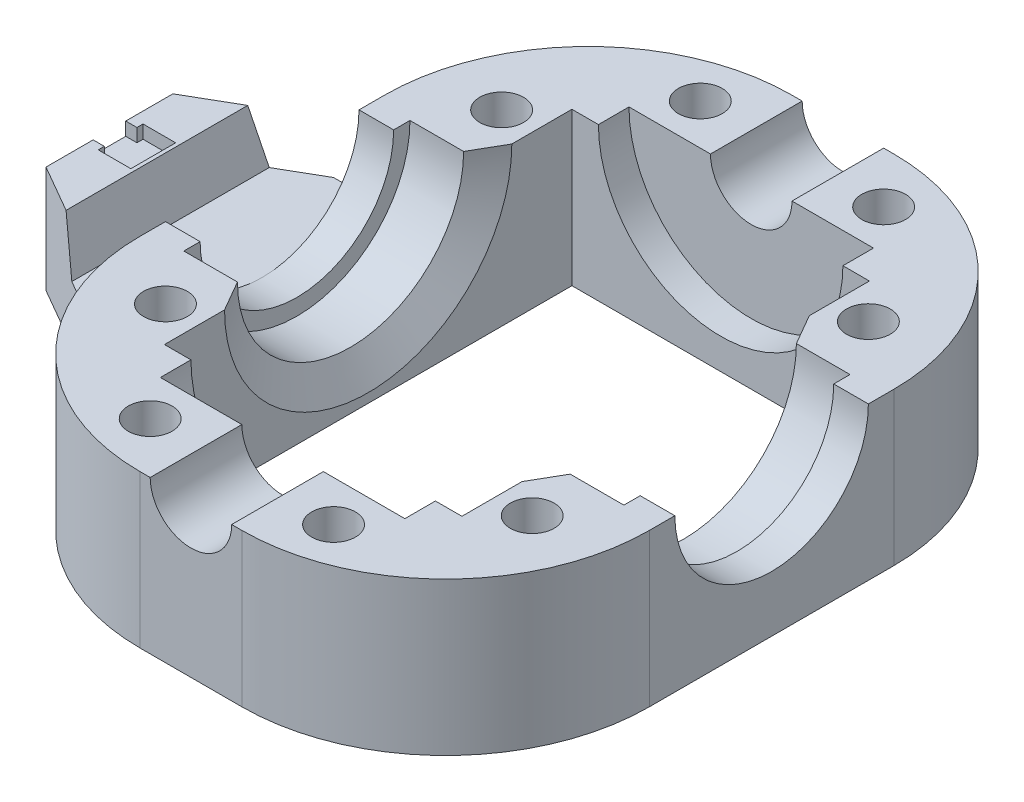
from build123d import *
from OCP.BRepFilletAPI import BRepFilletAPI_MakeChamfer

# Parameters (mm, degrees)
SKETCH1_W           = 50
SKETCH1_H           = 64
SKETCH1_W_2         = 29.2
SKETCH1_H_2         = 40
BOSS_EXTRUDE1_DEPTH = 15
SKETCH3_W           = 7
SKETCH3_H           = 11.1
SKETCH4_R           = 9.5
CUT_EXTRUDE2_DEPTH  = 62.229078059
SKETCH5_R           = 4
CUT_EXTRUDE3_DEPTH  = 71.32780389
SKETCH8_R           = 2.15
CUT_EXTRUDE6_DEPTH  = 44.289721644
FILLET1_R           = 20
CHAMFER1_SIZE       = 3
CHAMFER1_SIZE2      = 1.732050808
SKETCH9_W           = 12
SKETCH9_H           = 3
SKETCH10_W          = 24
SKETCH10_H          = 5.5
BOSS_EXTRUDE2_DEPTH = 15
BOSS_EXTRUDE3_START = 9
SKETCH12_W          = 24
SKETCH12_H          = 3.7
BOSS_EXTRUDE3_DEPTH = 6
BOSS_EXTRUDE4_DEPTH = 1.3
CHAMFER2_SIZE2      = 1.339745962
CHAMFER2_SIZE       = 5
CHAMFER3_SIZE       = 10
CHAMFER3_SIZE2      = 5.773502692


with BuildPart() as part:
    # Sketch1 → Boss-Extrude1 (new body)
    with BuildSketch(Plane(origin=(0, 0, 0), x_dir=(1, 0, 0), z_dir=(0, 1, 0))):
        Rectangle(SKETCH1_W, SKETCH1_H)
        Rectangle(SKETCH1_W_2, SKETCH1_H_2, mode=Mode.SUBTRACT)
    extrude(amount=BOSS_EXTRUDE1_DEPTH)

    # Sketch3 → Cut-Revolve1 (revolve, cut)
    with BuildSketch(Plane(origin=(0, 15, 0), x_dir=(1, 0, 0), z_dir=(0, 1, 0))):
        with Locations((18.1, -5.55)):
            Rectangle(SKETCH3_W, SKETCH3_H)
        with Locations((-18.1, -5.55)):
            Rectangle(SKETCH3_W, SKETCH3_H)
    revolve(axis=Axis((14.6, 15, 0), (1, 0, 0)), mode=Mode.SUBTRACT)

    # Sketch4 → Cut-Extrude2 (cut, through all)
    with BuildSketch(Plane(origin=(25, 0, 0), x_dir=(0, 0, -1), z_dir=(1, 0, 0))):
        with Locations((0, 15)):
            Circle(SKETCH4_R)
    extrude(amount=-CUT_EXTRUDE2_DEPTH, mode=Mode.SUBTRACT)

    # Sketch5 → Cut-Extrude3 (cut, through all)
    with BuildSketch(Plane.XY.offset(32)):
        with Locations((0, 15)):
            Circle(SKETCH5_R)
    extrude(amount=-CUT_EXTRUDE3_DEPTH, mode=Mode.SUBTRACT)

    # Sketch8 → Cut-Extrude6 (cut, through all)
    with BuildSketch(Plane(origin=(0, 15, 0), x_dir=(1, 0, 0), z_dir=(0, 1, 0))):
        with Locations(Location((18, 16.5, 0), (0, 0, 270))):
            Circle(SKETCH8_R)
        with Locations(Location((18, -16.5, 0), (0, 0, 270))):
            Circle(SKETCH8_R)
        with Locations(Location((-18, -16.5, 0), (0, 0, 270))):
            Circle(SKETCH8_R)
        with Locations(Location((-18, 16.5, 0), (0, 0, 270))):
            Circle(SKETCH8_R)
        with Locations(Location((9, -27, 0), (0, 0, 270))):
            Circle(SKETCH8_R)
        with Locations(Location((-9, -27, 0), (0, 0, 270))):
            Circle(SKETCH8_R)
        with Locations(Location((-9, 27, 0), (0, 0, 270))):
            Circle(SKETCH8_R)
        with Locations(Location((9, 27, 0), (0, 0, 270))):
            Circle(SKETCH8_R)
    extrude(amount=-CUT_EXTRUDE6_DEPTH, mode=Mode.SUBTRACT)

    # Fillet1
    fillet1_edges = [part.edges().sort_by_distance(p)[0] for p in [
        (-25, 7.5, -32),
        (25, 7.5, -32),
        (25, 7.5, 32),
        (-25, 7.5, 32),
    ]]
    fillet(fillet1_edges, radius=FILLET1_R)

    # Chamfer1: one chamfer whose edges measure the first distance from different faces: ONE call of the kernel's chamfer builder (chamfer() names one face for all edges)
    chamfer1_edges_1 = [part.edges().sort_by_distance(p)[0] for p in [
        (14.6, 3.9, 0),
    ]]
    chamfer1_side_1 = [part.faces().sort_by_distance(p)[0] for p in [
        (14.6, 0.427200187, 0),
    ]]
    chamfer1_edges_2 = [part.edges().sort_by_distance(p)[0] for p in [
        (-14.6, 3.9, 0),
    ]]
    chamfer1_side_2 = [part.faces().sort_by_distance(p)[0] for p in [
        (-14.6, 0.427200187, 0),
    ]]
    chamfer1 = BRepFilletAPI_MakeChamfer(part.part.solid().wrapped)
    for e in chamfer1_edges_1:
        chamfer1.Add(CHAMFER1_SIZE, CHAMFER1_SIZE2, e.wrapped, chamfer1_side_1[0].wrapped)  # the first distance lies on this face
    for e in chamfer1_edges_2:
        chamfer1.Add(CHAMFER1_SIZE, CHAMFER1_SIZE2, e.wrapped, chamfer1_side_2[0].wrapped)  # the first distance lies on this face
    add(Compound.cast(chamfer1.Shape()), mode=Mode.REPLACE)

    # Sketch9 → Cut-Revolve2 (revolve, cut)
    with BuildSketch(Plane(origin=(0, 15, 0), x_dir=(1, 0, 0), z_dir=(0, 1, 0))):
        with Locations((-6, -21.5)):
            Rectangle(SKETCH9_W, SKETCH9_H)
        with Locations((-6, 21.5)):
            Rectangle(SKETCH9_W, SKETCH9_H)
    revolve(axis=Axis((0, 15, -29.871415895), (0, 0, 1)), mode=Mode.SUBTRACT)

    # Sketch10 → Boss-Extrude2 (add)
    with BuildSketch(Plane.ZY.offset(25)):
        with Locations((0, 2.75)):
            Rectangle(SKETCH10_W, SKETCH10_H)
    extrude(amount=BOSS_EXTRUDE2_DEPTH)

    # Sketch12 → Boss-Extrude3 (add)
    with BuildSketch(Plane.ZY.offset(25).offset(BOSS_EXTRUDE3_START)):
        with Locations((0, 7.35)):
            Rectangle(SKETCH12_W, SKETCH12_H)
    extrude(amount=BOSS_EXTRUDE3_DEPTH)

    # Sketch13 → Boss-Extrude4 (add)
    with BuildSketch(Plane(origin=(0, 9.2, 0), x_dir=(1, 0, 0), z_dir=(0, 1, 0))):
        Polygon((-38.9, 2.2), (-38.9, 1.6), (-40, 1.6), (-40, 12), (-34, 12), (-34, -12), (-40, -12), (-40, -1.6), (-38.9, -1.6), (-38.9, -2.2), (-35.7, -2.2), (-35.7, 2.2), align=None)
    extrude(amount=BOSS_EXTRUDE4_DEPTH)

    # Chamfer2
    chamfer2_edges = [part.edges().sort_by_distance(p)[0] for p in [
        (-34, 10.5, 0),
    ]]
    chamfer2_side = [part.faces().sort_by_distance(p)[0] for p in [
        (-34, 10.473205081, 0),
    ]]
    chamfer(chamfer2_edges, length=CHAMFER2_SIZE - 0.0001, length2=CHAMFER2_SIZE2 - 0.0001, reference=chamfer2_side[0])  # a hair under: the kernel refuses the full size

    # Chamfer3: one chamfer whose edges measure the first distance from different faces: ONE call of the kernel's chamfer builder (chamfer() names one face for all edges)
    chamfer3_edges_1 = [part.edges().sort_by_distance(p)[0] for p in [
        (-40, 5.25, 12),
    ]]
    chamfer3_side_1 = [part.faces().sort_by_distance(p)[0] for p in [
        (-33.677093858, 4.00630158, 12),
    ]]
    chamfer3_edges_2 = [part.edges().sort_by_distance(p)[0] for p in [
        (-40, 5.25, -12),
    ]]
    chamfer3_side_2 = [part.faces().sort_by_distance(p)[0] for p in [
        (-33.677093858, 4.00630158, -12),
    ]]
    chamfer3 = BRepFilletAPI_MakeChamfer(part.part.solid().wrapped)
    for e in chamfer3_edges_1:
        chamfer3.Add(CHAMFER3_SIZE, CHAMFER3_SIZE2, e.wrapped, chamfer3_side_1[0].wrapped)  # the first distance lies on this face
    for e in chamfer3_edges_2:
        chamfer3.Add(CHAMFER3_SIZE, CHAMFER3_SIZE2, e.wrapped, chamfer3_side_2[0].wrapped)  # the first distance lies on this face
    add(Compound.cast(chamfer3.Shape()), mode=Mode.REPLACE)


solid = part.part
